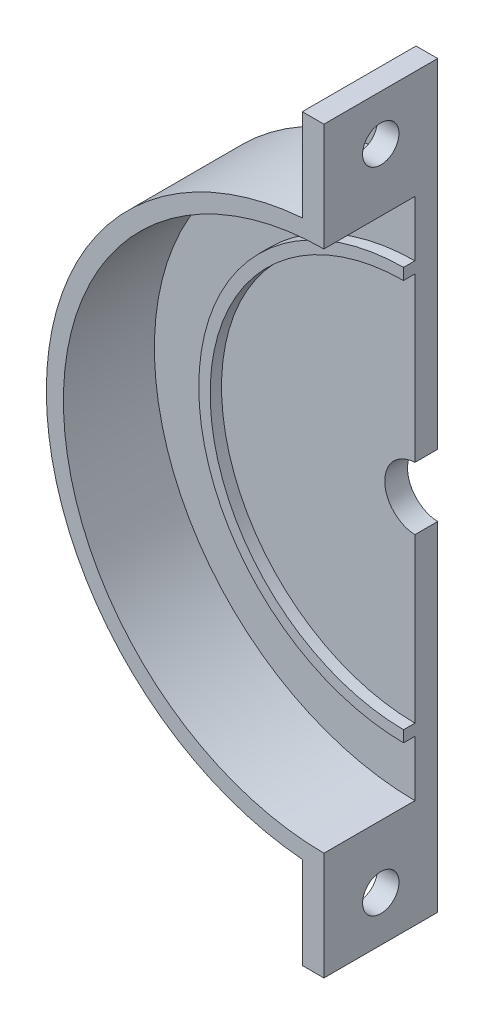
from build123d import *

# Parameters (mm, degrees)
BOSS_EXTRUDE1_DEPTH = 2
BOSS_EXTRUDE2_DEPTH = 10
BOSS_EXTRUDE3_DEPTH = 10
SKETCH3_R           = 1.6
CUT_EXTRUDE1_DEPTH  = 10
BOSS_EXTRUDE4_DEPTH = 1
MOVE_FACE1_DEPTH    = 10
BOSS_EXTRUDE5_DEPTH = 1


# Read off the part's stored shape, not the designer's step: Move Face1
with BuildPart() as part:
    # Sketch1 → Boss-Extrude1 (new body)
    with BuildSketch(Plane.XY):
        with BuildLine():
            Line((0, 23), (0, 2.65))
            ThreePointArc((0, 2.65), (-2.65, 0), (0, -2.65))
            Line((0, -2.65), (0, -23))
            ThreePointArc((0, -23), (-23, 0), (0, 23))
        make_face()
    extrude(amount=BOSS_EXTRUDE1_DEPTH)

    # Sketch2 → Boss-Extrude2 (add)
    with BuildSketch(Plane.XY):
        with BuildLine():
            Line((0, 23), (0, 24.5))
            ThreePointArc((0, 24.5), (-24.5, 0), (0, -24.5))
            Line((0, -24.5), (0, -23))
            ThreePointArc((0, -23), (-23, 0), (0, 23))
        make_face()
    extrude(amount=BOSS_EXTRUDE2_DEPTH)

    # Sketch4 → Boss-Extrude3 (add)
    with BuildSketch(Plane.XY.offset(10)):
        Polygon((0, -24.5), (-0.271688165, -23.208442848), (-2, -23.208442848), (-2, -32.5), (0, -32.5), align=None)
    boss_extrude3 = extrude(amount=-BOSS_EXTRUDE3_DEPTH)

    # Sketch3 → Cut-Extrude1 (cut)
    with BuildSketch(Plane(origin=(0, 0, 0), x_dir=(0, 0, -1), z_dir=(1, 0, 0))):
        with Locations(Location((-5, -28.5, 0), (0, 0, 90))):
            Circle(SKETCH3_R)
    cut_extrude1 = extrude(amount=-CUT_EXTRUDE1_DEPTH, mode=Mode.SUBTRACT)

    # Sketch5 → Boss-Extrude4 (add)
    with BuildSketch(Plane(origin=(0, 0, 0), x_dir=(-1, 0, 0), z_dir=(0, 0, -1))):
        Polygon((2, -32.5), (9.124047282, -22.73767273), (2, -22.73767273), align=None)
    boss_extrude4 = extrude(amount=-BOSS_EXTRUDE4_DEPTH)

    # Mirror1: Boss-Extrude3, Cut-Extrude1, Boss-Extrude4 across plane
    add(boss_extrude3.mirror(Plane.ZX))
    add(cut_extrude1.mirror(Plane.ZX), mode=Mode.SUBTRACT)
    add(boss_extrude4.mirror(Plane.ZX))

    # Move Face1 outline → Move Face1 (cut)
    with BuildSketch(Plane.XY):
        with BuildLine():
            ThreePointArc((-0.1, 2.748181217), (-2.75, 0), (-0.1, -2.748181217))
            Line((-0.1, -2.748181217), (-0.1, -32.5))
            Line((-0.1, -32.5), (0, -32.5))
            Line((0, -32.5), (0, -2.65))
            ThreePointArc((0, -2.65), (-2.65, 0), (0, 2.65))
            Line((0, 2.65), (0, 32.5))
            Line((0, 32.5), (-0.1, 32.5))
            Line((-0.1, 32.5), (-0.1, 2.748181217))
        make_face()
    extrude(amount=MOVE_FACE1_DEPTH, mode=Mode.SUBTRACT)

    # Sketch6 → Boss-Extrude5 (add)
    with BuildSketch(Plane.XY.offset(2)):
        with BuildLine():
            Line((-0.1, 17.0997076), (-0.1, 18.099723755))
            ThreePointArc((-0.1, 18.099723755), (-18.1, 0), (-0.1, -18.099723755))
            Line((-0.1, -18.099723755), (-0.1, -17.0997076))
            ThreePointArc((-0.1, -17.0997076), (-17.1, 0), (-0.1, 17.0997076))
        make_face()
    extrude(amount=BOSS_EXTRUDE5_DEPTH)


solid = part.part
